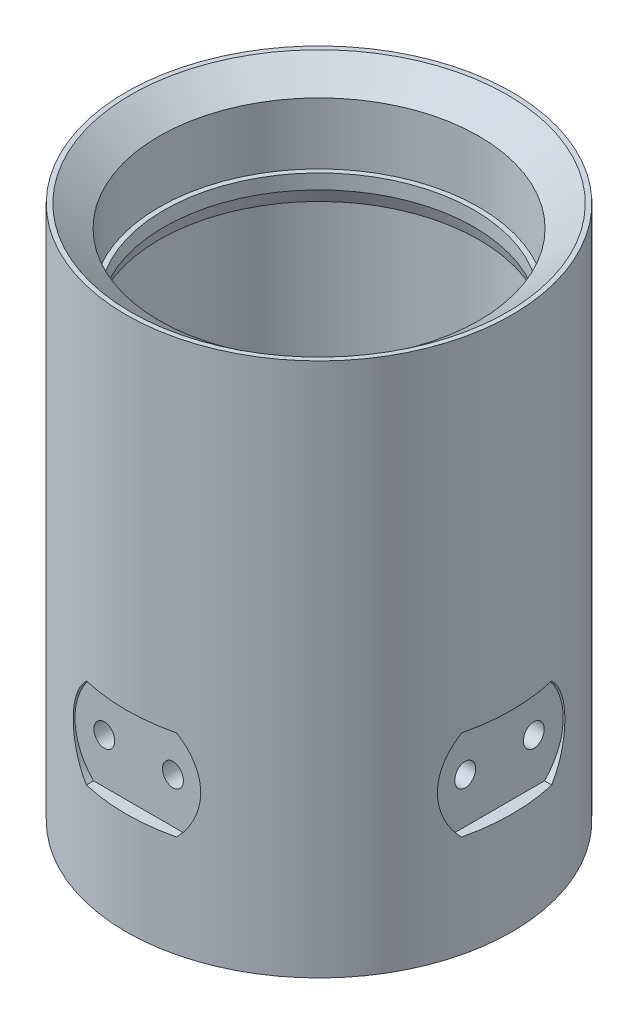
from build123d import *

# Parameters (mm, degrees)
SKETCH2_R               = 39.35
SKETCH2_R_2             = 32.6
BOSS_EXTRUDE1_DEPTH     = 109
CUT_EXTRUDE1_START      = 36.8
CUT_EXTRUDE1_DEPTH      = 125.884006308
CUT_EXTRUDE2_REACH      = 140.666
CUT_EXTRUDE2_END_RADIUS = 32.6
SKETCH4_RX              = 2.3375
SKETCH4_RY              = 2.125
CIRPATTERN1_COUNT       = 4
CHAMFER1_SIZE           = 5.8
CHAMFER1_SIZE2          = 4.4
SKETCH5_R               = 32.6
SKETCH5_R_2             = 31.6
BOSS_EXTRUDE2_DEPTH     = 3
BOSS_EXTRUDE3_START     = -86.05
SKETCH6_R               = 32.6
SKETCH6_R_2             = 31.6
BOSS_EXTRUDE3_DEPTH     = 6
CHAMFER2_SIZE           = 1.091910703
CHAMFER2_SIZE_2         = 3
BOSS_EXTRUDE4_START     = -10.2
SKETCH7_R               = 32.6
SKETCH7_R_2             = 31.6
BOSS_EXTRUDE4_DEPTH     = 3


with BuildPart() as part:
    # Sketch2 → Boss-Extrude1 (new body)
    with BuildSketch(Plane(origin=(0, 0, 0), x_dir=(1, 0, 0), z_dir=(0, 1, 0))):
        with Locations(Location((0, 0, 0), (0, 0, 270))):
            Circle(SKETCH2_R)
        with Locations(Location((0, 0, 0), (0, 0, 270))):
            Circle(SKETCH2_R_2, mode=Mode.SUBTRACT)
    extrude(amount=BOSS_EXTRUDE1_DEPTH)

    # Sketch3 → Cut-Extrude1 (cut)
    with BuildSketch(Plane.XY.offset(CUT_EXTRUDE1_START)):
        with BuildLine():
            Line((9.192388155, 39.192388155), (-9.192388155, 39.192388155))
            ThreePointArc((-9.192388155, 39.192388155), (-13, 30), (-9.192388155, 20.807611845))
            Line((-9.192388155, 20.807611845), (9.192388155, 20.807611845))
            ThreePointArc((9.192388155, 20.807611845), (13, 30), (9.192388155, 39.192388155))
        make_face()
    cut_extrude1 = extrude(amount=CUT_EXTRUDE1_DEPTH, mode=Mode.SUBTRACT)

    # Cut-Extrude2: up to this cylinder (the profile starts outside it)
    cut_extrude2_end = Plane(origin=(0, 30, 0), z_dir=(0, -1, 0)) * Cylinder(CUT_EXTRUDE2_END_RADIUS, 347.532, mode=Mode.PRIVATE)
    # Sketch4 → Cut-Extrude2 (cut, up to the surface)
    with BuildSketch(Plane.XY.offset(36.8), mode=Mode.PRIVATE) as cut_extrude2_sk1:
        with Locations(Location((-7, 29.999999845), (0, 0, 90))):
            Ellipse(SKETCH4_RX, SKETCH4_RY)
    cut_extrude2_tool1 = extrude(cut_extrude2_sk1.sketch, amount=-CUT_EXTRUDE2_REACH, mode=Mode.PRIVATE) - cut_extrude2_end
    # Sketch4 → Cut-Extrude2 (cut, up to the surface)
    with BuildSketch(Plane.XY.offset(36.8), mode=Mode.PRIVATE) as cut_extrude2_sk2:
        with Locations(Location((7, 29.999999845), (0, 0, -90))):
            Ellipse(SKETCH4_RX, SKETCH4_RY)
    cut_extrude2_tool2 = extrude(cut_extrude2_sk2.sketch, amount=-CUT_EXTRUDE2_REACH, mode=Mode.PRIVATE) - cut_extrude2_end
    cut_extrude2 = cut_extrude2_tool1.solids().sort_by_distance((-7, 30, 36.8))[0] + cut_extrude2_tool2.solids().sort_by_distance((7, 30, 36.8))[0]
    add(cut_extrude2, mode=Mode.SUBTRACT)

    # CirPattern1: Cut-Extrude1, Cut-Extrude2 ×4 about axis
    cirpattern1_axis = Axis((0, 109, 0), (0, -1, 0))
    add([cut_extrude1.rotate(cirpattern1_axis, i * 360 / CIRPATTERN1_COUNT) for i in range(1, CIRPATTERN1_COUNT)], mode=Mode.SUBTRACT)
    add([cut_extrude2.rotate(cirpattern1_axis, i * 360 / CIRPATTERN1_COUNT) for i in range(1, CIRPATTERN1_COUNT)], mode=Mode.SUBTRACT)

    # Chamfer1
    chamfer1_edges = [part.edges().sort_by_distance(p)[0] for p in [
        (0, 109, -32.6),
    ]]
    chamfer1_side = [part.faces().sort_by_distance(p)[0] for p in [
        (0, 109, -38.237013926),
    ]]
    chamfer(chamfer1_edges, length=CHAMFER1_SIZE, length2=CHAMFER1_SIZE2, reference=chamfer1_side[0])

    # Sketch5 → Boss-Extrude2 (add)
    with BuildSketch(Plane(origin=(0, 0, 0), x_dir=(-1, 0, 0), z_dir=(0, -1, 0))):
        with Locations(Location((0, 0, 0), (0, 0, 90))):
            Circle(SKETCH5_R)
        with Locations(Location((0, 0, 0), (0, 0, 90))):
            Circle(SKETCH5_R_2, mode=Mode.SUBTRACT)
    extrude(amount=-BOSS_EXTRUDE2_DEPTH)

    # Sketch6 → Boss-Extrude3 (add)
    with BuildSketch(Plane.XZ.offset(BOSS_EXTRUDE3_START)):
        with Locations(Location((0, 0, 0), (0, 0, 270))):
            Circle(SKETCH6_R)
        with Locations(Location((0, 0, 0), (0, 0, 270))):
            Circle(SKETCH6_R_2, mode=Mode.SUBTRACT)
    extrude(amount=-BOSS_EXTRUDE3_DEPTH)

    # Chamfer2
    # the kernel refuses this chamfer: 3, 1.091910703 mm, written as the material it takes off along each edge
    with BuildSketch(Plane(origin=(0, 86.05, 0), x_dir=(0, 0, -1), z_dir=(-1, 0, 0))) as chamfer2_piece_1_section:
        Polygon((31.6 + CHAMFER2_SIZE, 0), (31.6, -CHAMFER2_SIZE_2), (31.6, 0), align=None)
    chamfer2_piece_1 = revolve(axis=Axis((0, 86.05, 0), (0, -1, 0)), mode=Mode.PRIVATE)
    chamfer2_piece_1 = chamfer2_piece_1 & Plane(origin=(0, 87.707834406, 0), x_dir=(0, 0, 1), z_dir=(0, -1, 0)) * Cylinder(32.6, 131, mode=Mode.PRIVATE)
    add(chamfer2_piece_1, mode=Mode.SUBTRACT)


with BuildPart() as body_2:
    # Sketch7 → Boss-Extrude4 (new body)
    with BuildSketch(Plane.XZ.offset(BOSS_EXTRUDE4_START)):
        with Locations(Location((0, 0, 0), (0, 0, 270))):
            Circle(SKETCH7_R)
        with Locations(Location((0, 0, 0), (0, 0, 270))):
            Circle(SKETCH7_R_2, mode=Mode.SUBTRACT)
    extrude(amount=-BOSS_EXTRUDE4_DEPTH)


solid = Compound([part.part, body_2.part])
